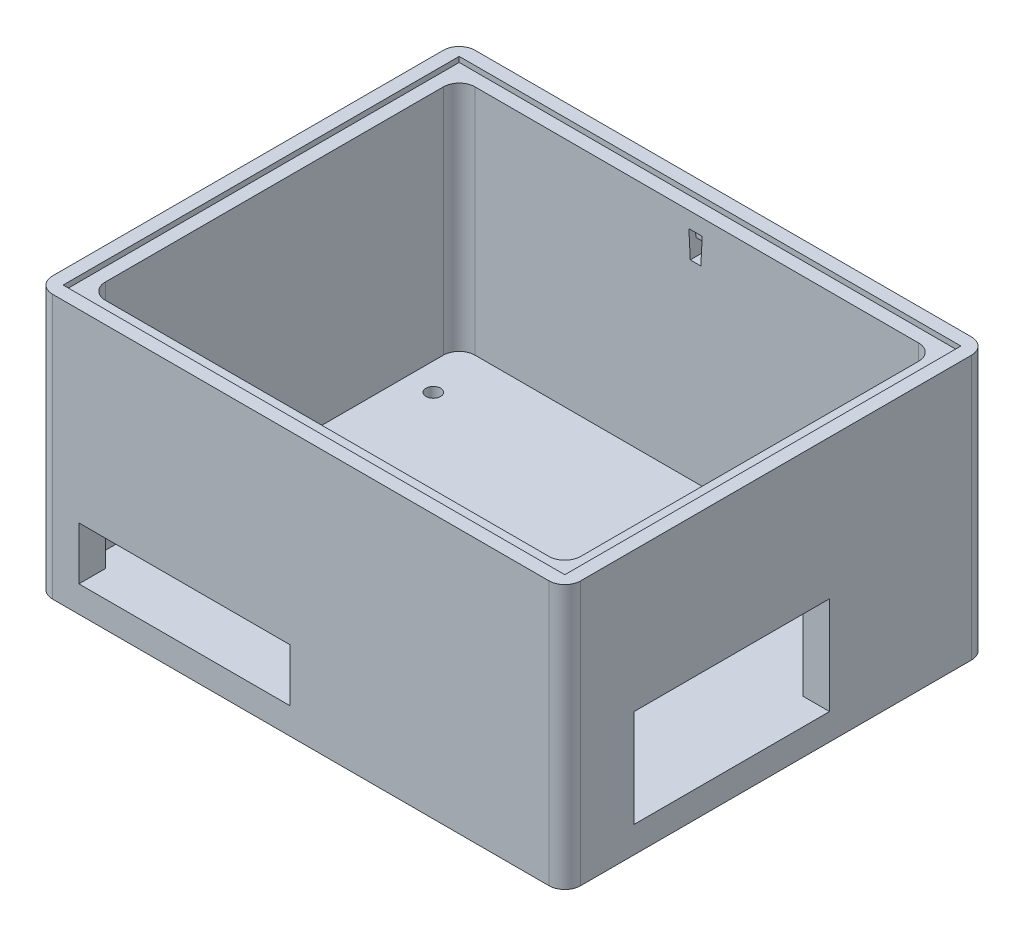
from build123d import *

# Parameters (mm, degrees)
SKETCH2_W            = 100
SKETCH2_H            = 80
BOSS_EXTRUDE1_DEPTH  = 50
SKETCH3_W            = 90
SKETCH3_H            = 70
CUT_EXTRUDE1_DEPTH   = 45
FILLET2_R            = 3
SKETCH4_W            = 95
SKETCH4_H            = 75
CUT_EXTRUDE2_DEPTH   = 1
SKETCH5_W            = 40
SKETCH5_H            = 10
CUT_EXTRUDE3_DEPTH   = 10
SNAP_START           = -38.217722162
SNAP_GROOVE1_DEPTH   = 3.217722162
SNAP_START_2         = -36.217722162
SNAP_GROOVE1_2_DEPTH = 1.217722162
SKETCH8_R            = 1.375
CUT_EXTRUDE4_DEPTH   = 82.240384046
LPATTERN1_COUNT      = 2
LPATTERN1_PITCH      = 58
LPATTERN1_COUNT_DIR2 = 2
LPATTERN1_PITCH_DIR2 = 49
SKETCH9_W            = 37
SKETCH9_H            = 18.5
CUT_EXTRUDE6_DEPTH   = 10


# Read off the part's stored shape, not the designer's step: Snap Groove1
with BuildPart() as part:
    # Sketch2 → Boss-Extrude1 (new body)
    with BuildSketch(Plane(origin=(0, 0, 0), x_dir=(1, 0, 0), z_dir=(0, 1, 0))):
        Rectangle(SKETCH2_W, SKETCH2_H)
    extrude(amount=BOSS_EXTRUDE1_DEPTH)

    # Sketch3 → Cut-Extrude1 (cut)
    with BuildSketch(Plane(origin=(0, 50, 0), x_dir=(1, 0, 0), z_dir=(0, 1, 0))):
        Rectangle(SKETCH3_W, SKETCH3_H)
    extrude(amount=-CUT_EXTRUDE1_DEPTH, mode=Mode.SUBTRACT)

    # Fillet2
    fillet2_edges = [part.edges().sort_by_distance(p)[0] for p in [
        (45, 27.5, -35),
        (45, 27.5, 35),
        (-45, 27.5, 35),
        (-45, 27.5, -35),
        (50, 25, 40),
        (-50, 25, 40),
        (-50, 25, -40),
        (50, 25, -40),
    ]]
    fillet(fillet2_edges, radius=FILLET2_R)

    # Sketch4 → Cut-Extrude2 (cut)
    with BuildSketch(Plane(origin=(0, 50, 0), x_dir=(1, 0, 0), z_dir=(0, 1, 0))):
        Rectangle(SKETCH4_W, SKETCH4_H)
    extrude(amount=-CUT_EXTRUDE2_DEPTH, mode=Mode.SUBTRACT)

    # Sketch5 → Cut-Extrude3 (cut)
    with BuildSketch(Plane.XY.offset(40)):
        with Locations((-22, 10)):
            Rectangle(SKETCH5_W, SKETCH5_H)
    extrude(amount=-CUT_EXTRUDE3_DEPTH, mode=Mode.SUBTRACT)

    # Snap Groove1 outline → Snap Groove1 (cut)
    with BuildSketch(Plane.XY.offset(SNAP_START)):
        Polygon((-1.245807146, 41), (0.754192854, 41), (0.911416192, 44), (-1.403030484, 44), align=None)
    snap_groove1 = extrude(amount=SNAP_GROOVE1_DEPTH, mode=Mode.SUBTRACT)

    # Snap Groove1 2 outline → Snap Groove1 2 (cut)
    with BuildSketch(Plane.XY.offset(SNAP_START_2)):
        Polygon((-1.403030484, 44), (0.911416192, 44), (1.01623175, 46), (-1.507846042, 46), align=None)
    snap_groove1_2 = extrude(amount=SNAP_GROOVE1_2_DEPTH, mode=Mode.SUBTRACT)

    # Mirror1: Snap Groove1, Snap Groove1 2 across plane
    add(snap_groove1.mirror(Plane.XY), mode=Mode.SUBTRACT)
    add(snap_groove1_2.mirror(Plane.XY), mode=Mode.SUBTRACT)

    # Sketch8 → Cut-Extrude4 (cut, through all)
    with BuildSketch(Plane.XZ):
        with Locations(Location((18.146559745, 24.040628208, 0), (0, 0, 270))):
            Circle(SKETCH8_R)
    cut_extrude4 = extrude(amount=-CUT_EXTRUDE4_DEPTH, mode=Mode.SUBTRACT)

    # LPattern1: Cut-Extrude4 2 × 2
    with Locations(*[(-i * LPATTERN1_PITCH, 0, -j * LPATTERN1_PITCH_DIR2) for i in range(LPATTERN1_COUNT) for j in range(LPATTERN1_COUNT_DIR2) if (i, j) != (0, 0)]):
        add(cut_extrude4, mode=Mode.SUBTRACT)

    # Sketch9 → Cut-Extrude6 (cut)
    with BuildSketch(Plane(origin=(50, 0, 0), x_dir=(0, 0, -1), z_dir=(1, 0, 0))):
        with Locations((-8.373367198, 14.25)):
            Rectangle(SKETCH9_W, SKETCH9_H)
    extrude(amount=-CUT_EXTRUDE6_DEPTH, mode=Mode.SUBTRACT)


solid = part.part
